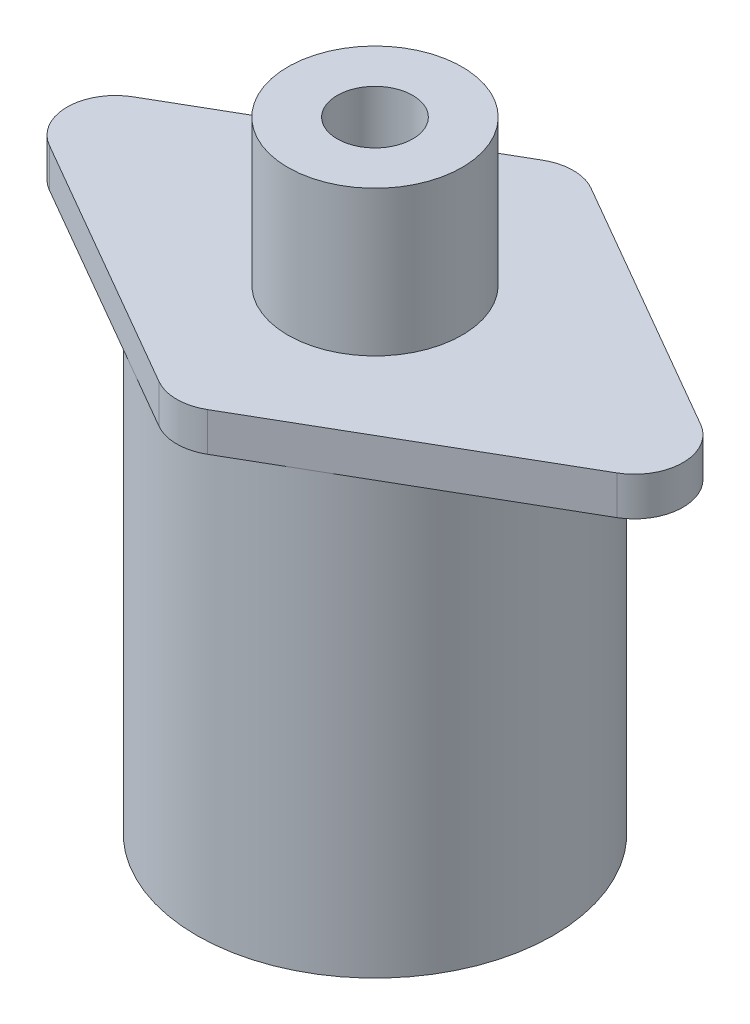
from build123d import *

# Parameters (mm, degrees)
SKETCH1_R           = 18.4
BOSS_EXTRUDE1_DEPTH = 45
BOSS_EXTRUDE2_DEPTH = 4
FILLET1_R           = 5
SKETCH3_R           = 9
BOSS_EXTRUDE3_DEPTH = 15
SKETCH4_R           = 3.9
CUT_EXTRUDE1_DEPTH  = 10


with BuildPart() as part:
    # Sketch1 → Boss-Extrude1 (new body)
    with BuildSketch(Plane(origin=(0, 0, 0), x_dir=(1, 0, 0), z_dir=(0, 1, 0))):
        Circle(SKETCH1_R)
    extrude(amount=BOSS_EXTRUDE1_DEPTH)

    # Sketch2 → Boss-Extrude2 (add)
    with BuildSketch(Plane(origin=(0, 45, 0), x_dir=(1, 0, 0), z_dir=(0, 1, 0))):
        Polygon((0, 21.25), (-36.806079661, 0), (0, -21.25), (36.806079661, 0), align=None)
    extrude(amount=BOSS_EXTRUDE2_DEPTH)

    # Fillet1
    fillet1_edges = [part.edges().sort_by_distance(p)[0] for p in [
        (0, 47, -21.25),
        (0, 47, 21.25),
        (36.806079661, 47, 0),
        (-36.806079661, 47, 0),
    ]]
    fillet(fillet1_edges, radius=FILLET1_R)

    # Sketch3 → Boss-Extrude3 (add)
    with BuildSketch(Plane(origin=(0, 49, 0), x_dir=(1, 0, 0), z_dir=(0, 1, 0))):
        Circle(SKETCH3_R)
    extrude(amount=BOSS_EXTRUDE3_DEPTH)

    # Sketch4 → Cut-Extrude1 (cut)
    with BuildSketch(Plane(origin=(0, 64, 0), x_dir=(1, 0, 0), z_dir=(0, 1, 0))):
        Circle(SKETCH4_R)
    extrude(amount=-CUT_EXTRUDE1_DEPTH, mode=Mode.SUBTRACT)


solid = part.part
